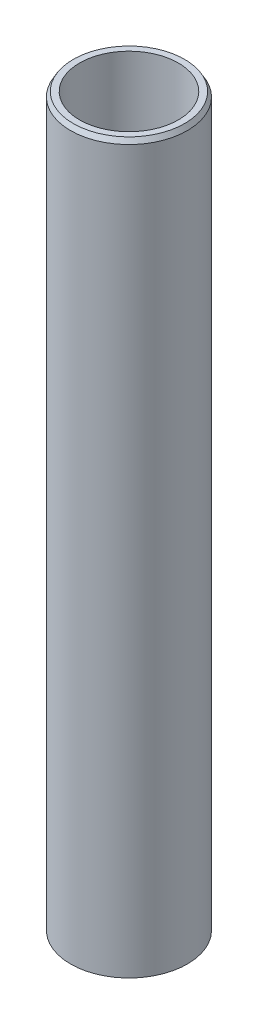
from build123d import *
from OCP.BRepFilletAPI import BRepFilletAPI_MakeChamfer

# Parameters (mm, degrees)
SKETCH1_R           = 35
BOSS_EXTRUDE1_DEPTH = 437.111828962
SKETCH2_R           = 29.593629566
CUT_EXTRUDE1_DEPTH  = 440.905388712
CHAMFER1_SIZE       = 2.831549422
CHAMFER1_SIZE2      = 1.634795821


with BuildPart() as part:
    # Sketch1 → Boss-Extrude1 (new body)
    with BuildSketch(Plane(origin=(0, 0, 0), x_dir=(1, 0, 0), z_dir=(0, 1, 0))):
        Circle(SKETCH1_R)
    extrude(amount=BOSS_EXTRUDE1_DEPTH)

    # Sketch2 → Cut-Extrude1 (cut, through all)
    with BuildSketch(Plane(origin=(0, 0, 0), x_dir=(1, 0, 0), z_dir=(0, 1, 0))):
        Circle(SKETCH2_R)
    extrude(amount=CUT_EXTRUDE1_DEPTH, mode=Mode.SUBTRACT)

    # Chamfer1: one chamfer whose edges measure the first distance from different faces: ONE call of the kernel's chamfer builder (chamfer() names one face for all edges)
    chamfer1_edges_1 = [part.edges().sort_by_distance(p)[0] for p in [
        (-35, 437.111828962, 0),
    ]]
    chamfer1_side_1 = [part.faces().sort_by_distance(p)[0] for p in [
        (-35, 218.555914481, 0),
    ]]
    chamfer1_edges_2 = [part.edges().sort_by_distance(p)[0] for p in [
        (-35, 0, 0),
    ]]
    chamfer1_side_2 = [part.faces().sort_by_distance(p)[0] for p in [
        (-34.010050506, 0, 0),
    ]]
    chamfer1 = BRepFilletAPI_MakeChamfer(part.part.solid().wrapped)
    for e in chamfer1_edges_1:
        chamfer1.Add(CHAMFER1_SIZE, CHAMFER1_SIZE2, e.wrapped, chamfer1_side_1[0].wrapped)  # the first distance lies on this face
    for e in chamfer1_edges_2:
        chamfer1.Add(CHAMFER1_SIZE, CHAMFER1_SIZE2, e.wrapped, chamfer1_side_2[0].wrapped)  # the first distance lies on this face
    add(Compound.cast(chamfer1.Shape()), mode=Mode.REPLACE)


solid = part.part
